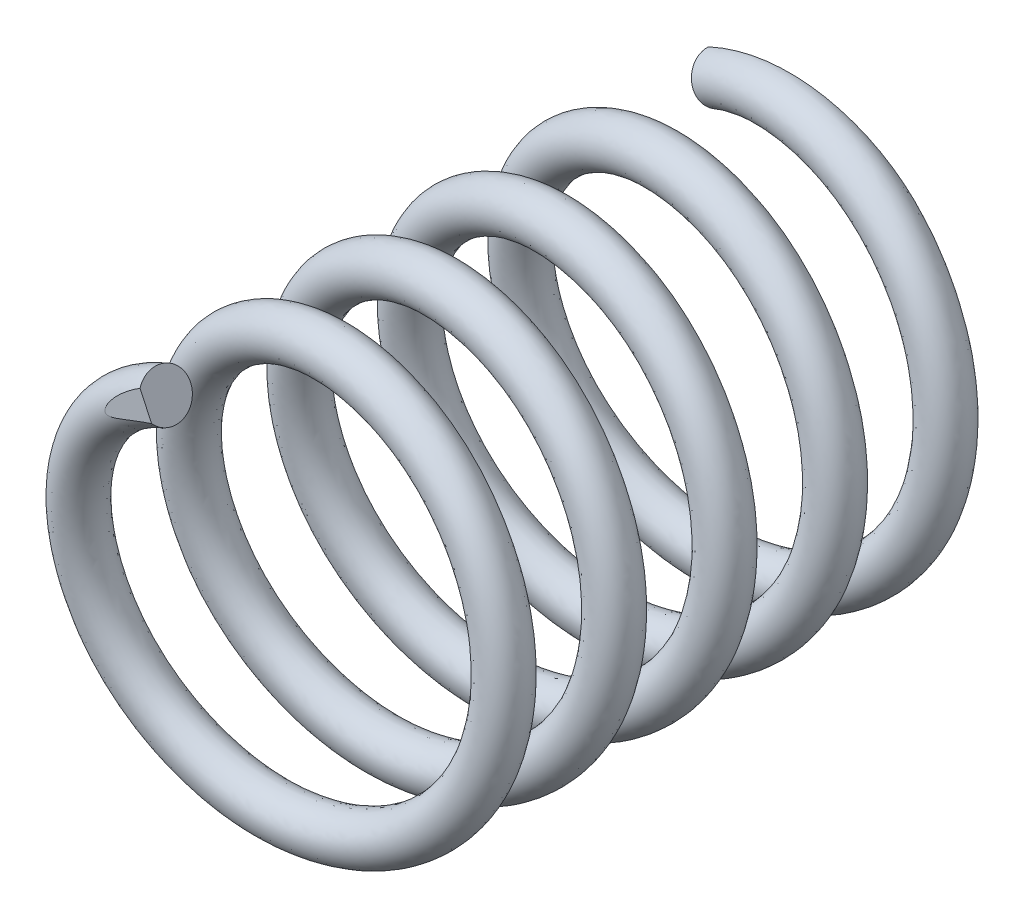
from build123d import *

# Parameters (mm, degrees)
SWEEP1_PROFILE_R = 3.175


with BuildPart() as part:
    # Sweep1: sweep along a curve in space
    with BuildLine() as sweep1_path:
        add(Edge.make_bspline(
            [(-10.734503848, 23.020217791, 0), (-1.199217431, 27.46659487, 0.9525), (8.68731164, 23.868192568, 1.905), (18.573840711, 20.269790266, 2.8575), (23.020217791, 10.734503848, 3.81), (27.46659487, 1.199217431, 4.7625), (23.868192568, -8.68731164, 5.715), (20.269790266, -18.573840711, 6.6675), (10.734503848, -23.020217791, 7.62), (1.199217431, -27.46659487, 8.5725), (-8.68731164, -23.868192568, 9.525), (-18.573840711, -20.269790266, 10.4775), (-23.020217791, -10.734503848, 11.43), (-27.46659487, -1.199217431, 12.3825), (-23.868192568, 8.68731164, 13.335), (-20.269790266, 18.573840711, 14.2875), (-10.734503848, 23.020217791, 15.24), (-1.199217431, 27.46659487, 16.1925), (8.68731164, 23.868192568, 17.145), (18.573840711, 20.269790266, 18.0975), (23.020217791, 10.734503848, 19.05), (27.46659487, 1.199217431, 20.0025), (23.868192568, -8.68731164, 20.955), (20.269790266, -18.573840711, 21.9075), (10.734503848, -23.020217791, 22.86), (1.199217431, -27.46659487, 23.8125), (-8.68731164, -23.868192568, 24.765), (-18.573840711, -20.269790266, 25.7175), (-23.020217791, -10.734503848, 26.67), (-27.46659487, -1.199217431, 27.6225), (-23.868192568, 8.68731164, 28.575), (-20.269790266, 18.573840711, 29.5275), (-10.734503848, 23.020217791, 30.48), (-1.199217431, 27.46659487, 31.4325), (8.68731164, 23.868192568, 32.385), (18.573840711, 20.269790266, 33.3375), (23.020217791, 10.734503848, 34.29), (27.46659487, 1.199217431, 35.2425), (23.868192568, -8.68731164, 36.195), (20.269790266, -18.573840711, 37.1475), (10.734503848, -23.020217791, 38.1), (1.199217431, -27.46659487, 39.0525), (-8.68731164, -23.868192568, 40.005), (-18.573840711, -20.269790266, 40.9575), (-23.020217791, -10.734503848, 41.91), (-27.46659487, -1.199217431, 42.8625), (-23.868192568, 8.68731164, 43.815), (-20.269790266, 18.573840711, 44.7675), (-10.734503848, 23.020217791, 45.72), (-1.199217431, 27.46659487, 46.6725), (8.68731164, 23.868192568, 47.625), (18.573840711, 20.269790266, 48.5775), (23.020217791, 10.734503848, 49.53), (27.46659487, 1.199217431, 50.4825), (23.868192568, -8.68731164, 51.435), (20.269790266, -18.573840711, 52.3875), (10.734503848, -23.020217791, 53.34), (1.199217431, -27.46659487, 54.2925), (-8.68731164, -23.868192568, 55.245), (-18.573840711, -20.269790266, 56.1975), (-23.020217791, -10.734503848, 57.15), (-27.46659487, -1.199217431, 58.1025), (-23.868192568, 8.68731164, 59.055), (-20.269790266, 18.573840711, 60.0075), (-10.734503848, 23.020217791, 60.96), (-1.199217431, 27.46659487, 61.9125), (8.68731164, 23.868192568, 62.865), (18.573840711, 20.269790266, 63.8175), (23.020217791, 10.734503848, 64.77), (27.46659487, 1.199217431, 65.7225), (23.868192568, -8.68731164, 66.675), (20.269790266, -18.573840711, 67.6275), (10.734503848, -23.020217791, 68.58), (1.199217431, -27.46659487, 69.5325), (-8.68731164, -23.868192568, 70.485), (-18.573840711, -20.269790266, 71.4375), (-23.020217791, -10.734503848, 72.39), (-27.46659487, -1.199217431, 73.3425), (-23.868192568, 8.68731164, 74.295), (-20.269790266, 18.573840711, 75.2475), (-10.734503848, 23.020217791, 76.2)],
            knots=[0, 0, 0, 0.025, 0.025, 0.05, 0.05, 0.075, 0.075, 0.1, 0.1, 0.125, 0.125, 0.15, 0.15, 0.175, 0.175, 0.2, 0.2, 0.225, 0.225, 0.25, 0.25, 0.275, 0.275, 0.3, 0.3, 0.325, 0.325, 0.35, 0.35, 0.375, 0.375, 0.4, 0.4, 0.425, 0.425, 0.45, 0.45, 0.475, 0.475, 0.5, 0.5, 0.525, 0.525, 0.55, 0.55, 0.575, 0.575, 0.6, 0.6, 0.625, 0.625, 0.65, 0.65, 0.675, 0.675, 0.7, 0.7, 0.725, 0.725, 0.75, 0.75, 0.775, 0.775, 0.8, 0.8, 0.825, 0.825, 0.85, 0.85, 0.875, 0.875, 0.9, 0.9, 0.925, 0.925, 0.95, 0.95, 0.975, 0.975, 1, 1, 1], degree=2, weights=[1, 0.923879533, 1, 0.923879533, 1, 0.923879533, 1, 0.923879533, 1, 0.923879533, 1, 0.923879533, 1, 0.923879533, 1, 0.923879533, 1, 0.923879533, 1, 0.923879533, 1, 0.923879533, 1, 0.923879533, 1, 0.923879533, 1, 0.923879533, 1, 0.923879533, 1, 0.923879533, 1, 0.923879533, 1, 0.923879533, 1, 0.923879533, 1, 0.923879533, 1, 0.923879533, 1, 0.923879533, 1, 0.923879533, 1, 0.923879533, 1, 0.923879533, 1, 0.923879533, 1, 0.923879533, 1, 0.923879533, 1, 0.923879533, 1, 0.923879533, 1, 0.923879533, 1, 0.923879533, 1, 0.923879533, 1, 0.923879533, 1, 0.923879533, 1, 0.923879533, 1, 0.923879533, 1, 0.923879533, 1, 0.923879533, 1, 0.923879533, 1]))
    # Sweep1 profile (on start of the path) → Sweep1 (sweep)
    with BuildSketch(Plane(origin=(-10.734503848, 23.020217791, 0), x_dir=(-0.4226182617407033, 0.9063077870366483, 0), z_dir=(0.9026163121586791, 0.4208968987352195, 0.09016425932785303))):
        Circle(SWEEP1_PROFILE_R)
    sweep(path=sweep1_path.line, is_frenet=True)

    # SurfaceCut1
    split(bisect_by=Plane.XY, keep=Keep.TOP)

    # SurfaceCut3
    split(bisect_by=Plane.XY.offset(78.74), keep=Keep.BOTTOM)


solid = part.part
